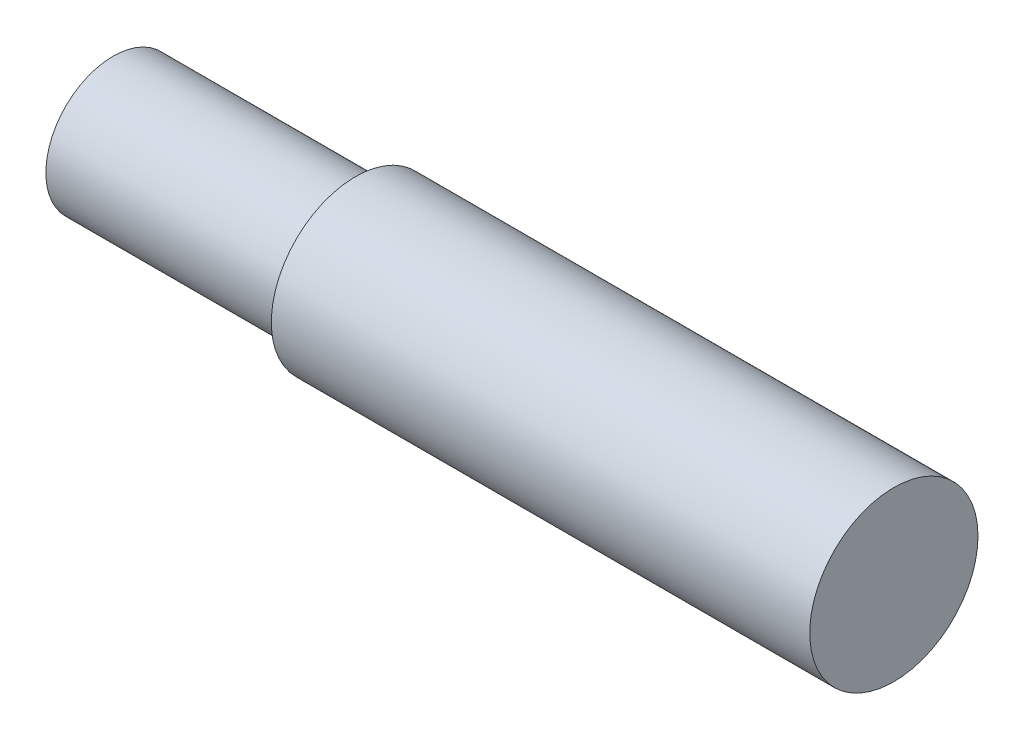
from build123d import *

# Parameters (mm, degrees)
SKETCH2_R           = 3.96875
BOSS_EXTRUDE1_DEPTH = 25.4
SKETCH3_R           = 3.175
BOSS_EXTRUDE2_DEPTH = 11.43


with BuildPart() as part:
    # Sketch2 → Boss-Extrude1 (new body)
    with BuildSketch(Plane(origin=(0, 0, 0), x_dir=(0, 0, -1), z_dir=(1, 0, 0))):
        Circle(SKETCH2_R)
    extrude(amount=BOSS_EXTRUDE1_DEPTH)

    # Sketch3 → Boss-Extrude2 (add)
    with BuildSketch(Plane(origin=(0, 0, 0), x_dir=(0, 0, -1), z_dir=(1, 0, 0))):
        Circle(SKETCH3_R)
    extrude(amount=-BOSS_EXTRUDE2_DEPTH)


solid = part.part
